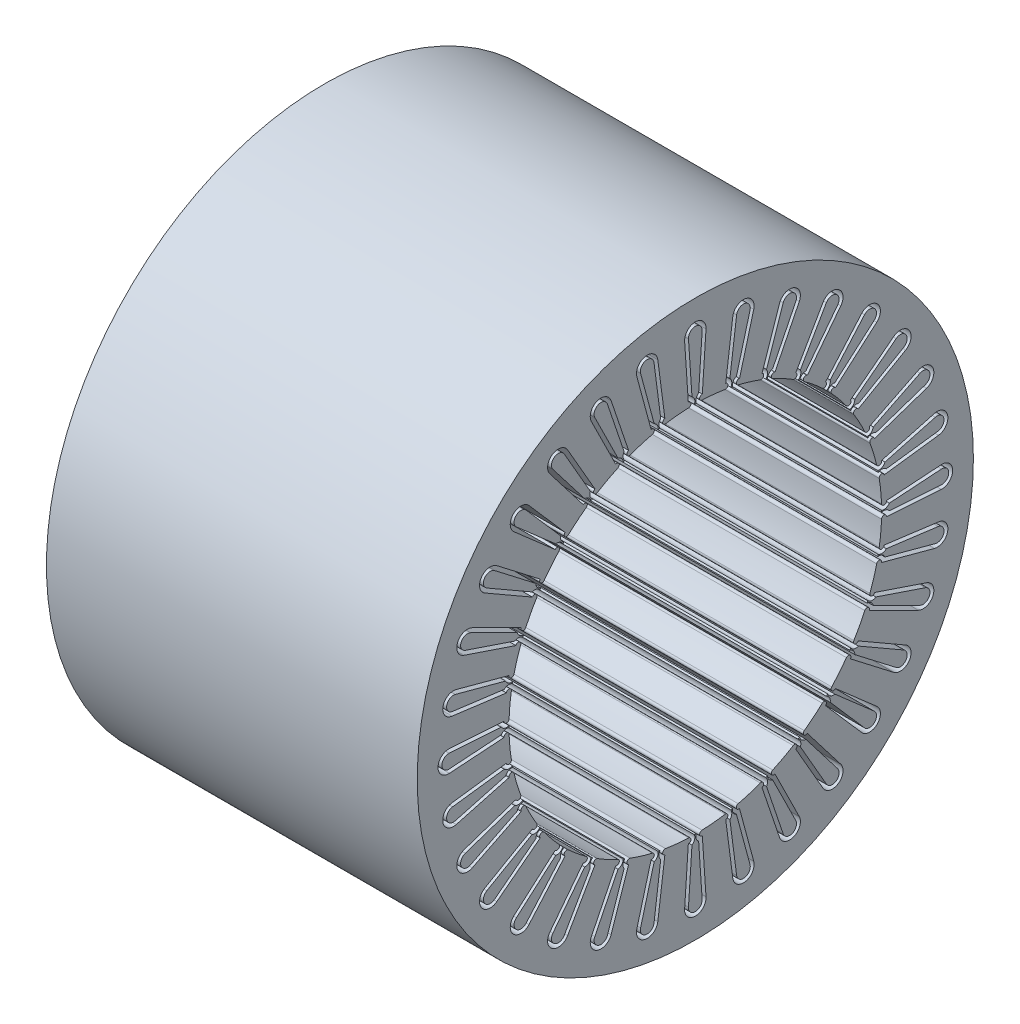
from build123d import *

# Parameters (mm, degrees)
SKETCH1_R               = 150
SKETCH1_R_2             = 100.5
BOSS_EXTRUDE1_DEPTH     = 200
CUT_EXTRUDE_THIN3_DEPTH = 200


with BuildPart() as part:
    # Sketch1 → Boss-Extrude1 (new body)
    with BuildSketch(Plane(origin=(0, 0, 0), x_dir=(0, 0, -1), z_dir=(1, 0, 0))):
        Circle(SKETCH1_R)
        Circle(SKETCH1_R_2, mode=Mode.SUBTRACT)
    extrude(amount=BOSS_EXTRUDE1_DEPTH)

    # Sketch2 → Cut-Extrude-Thin3 (cut)
    with BuildSketch(Plane(origin=(200, 0, 0), x_dir=(0, 0, -1), z_dir=(1, 0, 0))):
        with BuildLine():
            ThreePointArc((-3.689655933, 100.432248004), (-2.327243495, 101.84122861), (-3.781201437, 103.155534626))
            Line((-3.781201437, 103.155534626), (-5.76444464, 132.62086222))
            ThreePointArc((-5.76444464, 132.62086222), (0, 138.786340976), (5.76444464, 132.62086222))
            Line((5.76444464, 132.62086222), (3.781201437, 103.155534626))
            ThreePointArc((3.781201437, 103.155534626), (2.327243495, 101.84122861), (3.689655933, 100.432248004))
            Line((3.689655933, 100.432248004), (3.689655933, 98.352248004))
            ThreePointArc((3.689655933, 98.352248004), (0.39094782, 100.808501907), (1.798621582, 104.672840535))
            Line((1.798621582, 104.672840535), (3.68914023, 132.76054617))
            ThreePointArc((3.68914023, 132.76054617), (0, 136.706340976), (-3.68914023, 132.76054617))
            Line((-3.68914023, 132.76054617), (-1.798621582, 104.672840535))
            ThreePointArc((-1.798621582, 104.672840535), (-0.39094782, 100.808501907), (-3.689655933, 98.352248004))
            Line((-3.689655933, 98.352248004), (-3.689655933, 100.432248004))
        make_face()
        with BuildLine():
            ThreePointArc((23.212119833, 97.782654356), (22.150764248, 99.430355276), (23.83319318, 100.435754148))
            Line((23.83319318, 100.435754148), (31.526729169, 128.948002178))
            ThreePointArc((31.526729169, 128.948002178), (27.075871952, 136.11960035), (20.219364264, 131.197176901))
            Line((20.219364264, 131.197176901), (16.416099756, 101.91110576))
            ThreePointArc((16.416099756, 101.91110576), (17.58571192, 100.338400642), (15.974599375, 99.222286684))
            Line((15.974599375, 99.222286684), (15.568811505, 97.182253301))
            ThreePointArc((15.568811505, 97.182253301), (19.283327231, 98.947764946), (18.656596594, 103.012474918))
            Line((18.656596594, 103.012474918), (22.282043268, 130.929305058))
            ThreePointArc((22.282043268, 130.929305058), (26.670084083, 134.079566967), (29.518552139, 129.489873947))
            Line((29.518552139, 129.489873947), (22.184719739, 102.310687591))
            ThreePointArc((22.184719739, 102.310687591), (20.050198967, 98.795224673), (22.806331963, 95.742620972))
            Line((22.806331963, 95.742620972), (23.212119833, 97.782654356))
        make_face()
        with BuildLine():
            ThreePointArc((41.842554985, 91.375328138), (41.123043553, 93.19842915), (42.969288674, 93.856283962))
            Line((42.969288674, 93.856283962), (56.077459177, 120.319742728))
            ThreePointArc((56.077459177, 120.319742728), (53.11123333, 128.22185982), (45.426154338, 124.731657649))
            Line((45.426154338, 124.731657649), (35.982539442, 96.750290251))
            ThreePointArc((35.982539442, 96.750290251), (36.822858288, 94.979624207), (35.024959787, 94.199268532))
            Line((35.024959787, 94.199268532), (34.228978248, 92.277599104))
            ThreePointArc((34.228978248, 92.277599104), (38.216554832, 93.284520868), (38.394852225, 97.39339766))
            Line((38.394852225, 97.39339766), (47.39694034, 124.066524178))
            ThreePointArc((47.39694034, 124.066524178), (52.315251791, 126.300190392), (54.213582642, 121.242978486))
            Line((54.213582642, 121.242978486), (41.718271557, 96.016792299))
            ThreePointArc((41.718271557, 96.016792299), (38.938932211, 92.985302361), (41.046573446, 89.45365871))
            Line((41.046573446, 89.45365871), (41.842554985, 91.375328138))
        make_face()
        with BuildLine():
            ThreePointArc((58.865004215, 81.456499304), (58.514987357, 83.384939658), (60.454098502, 83.669969419))
            Line((60.454098502, 83.669969419), (78.473163877, 107.067663041))
            ThreePointArc((78.473163877, 107.067663041), (77.105559796, 115.396625124), (68.887242776, 113.472770745))
            Line((68.887242776, 113.472770745), (54.166190317, 87.871415346))
            ThreePointArc((54.166190317, 87.871415346), (54.644922863, 85.97083408), (52.729330638, 85.556225317))
            Line((52.729330638, 85.556225317), (51.573744553, 83.826768523))
            ThreePointArc((51.573744553, 83.826768523), (55.681141662, 84.036404969), (56.657615217, 88.031546749))
            Line((56.657615217, 88.031546749), (70.690399575, 112.435936351))
            ThreePointArc((70.690399575, 112.435936351), (75.949973711, 113.667168331), (76.825215569, 108.336783356))
            Line((76.825215569, 108.336783356), (59.648613596, 86.033025527))
            ThreePointArc((59.648613596, 86.033025527), (56.331264127, 83.602007025), (57.70941813, 79.72704251))
            Line((57.70941813, 79.72704251), (58.865004215, 81.456499304))
        make_face()
        with BuildLine():
            ThreePointArc((73.625304344, 68.407342883), (73.658233011, 70.367013698), (75.615691228, 70.268264874))
            Line((75.615691228, 70.268264874), (97.853188897, 89.701033107))
            ThreePointArc((97.853188897, 89.701033107), (98.13676284, 98.13676284), (89.701033107, 97.853188897))
            Line((89.701033107, 97.853188897), (70.268264874, 75.615691228))
            ThreePointArc((70.268264874, 75.615691228), (70.367013698, 73.658233011), (68.407342883, 73.625304344))
            Line((68.407342883, 73.625304344), (66.936560778, 72.154522239))
            ThreePointArc((66.936560778, 72.154522239), (71.005933444, 71.558817154), (72.743057831, 75.286692865))
            Line((72.743057831, 75.286692865), (91.267266397, 96.484498545))
            ThreePointArc((91.267266397, 96.484498545), (96.665980735, 96.665980735), (96.484498545, 91.267266397))
            Line((96.484498545, 91.267266397), (75.286692865, 72.743057831))
            ThreePointArc((75.286692865, 72.743057831), (71.558817154, 71.005933444), (72.154522239, 66.936560778))
            Line((72.154522239, 66.936560778), (73.625304344, 68.407342883))
        make_face()
        with BuildLine():
            ThreePointArc((85.556225317, 52.729330638), (85.97083408, 54.644922863), (87.871415346, 54.166190317))
            Line((87.871415346, 54.166190317), (113.472770745, 68.887242776))
            ThreePointArc((113.472770745, 68.887242776), (115.396625124, 77.105559796), (107.067663041, 78.473163877))
            Line((107.067663041, 78.473163877), (83.669969419, 60.454098502))
            ThreePointArc((83.669969419, 60.454098502), (83.384939658, 58.514987357), (81.456499304, 58.865004215))
            Line((81.456499304, 58.865004215), (79.72704251, 57.70941813))
            ThreePointArc((79.72704251, 57.70941813), (83.602007025, 56.331264127), (86.033025527, 59.648613596))
            Line((86.033025527, 59.648613596), (108.336783356, 76.825215569))
            ThreePointArc((108.336783356, 76.825215569), (113.667168331, 75.949973711), (112.435936351, 70.690399575))
            Line((112.435936351, 70.690399575), (88.031546749, 56.657615217))
            ThreePointArc((88.031546749, 56.657615217), (84.036404969, 55.681141662), (83.826768523, 51.573744553))
            Line((83.826768523, 51.573744553), (85.556225317, 52.729330638))
        make_face()
        with BuildLine():
            ThreePointArc((94.199268532, 35.024959787), (94.979624207, 36.822858288), (96.750290251, 35.982539442))
            Line((96.750290251, 35.982539442), (124.731657649, 45.426154338))
            ThreePointArc((124.731657649, 45.426154338), (128.22185982, 53.11123333), (120.319742728, 56.077459177))
            Line((120.319742728, 56.077459177), (93.856283962, 42.969288674))
            ThreePointArc((93.856283962, 42.969288674), (93.19842915, 41.123043553), (91.375328138, 41.842554985))
            Line((91.375328138, 41.842554985), (89.45365871, 41.046573446))
            ThreePointArc((89.45365871, 41.046573446), (92.985302361, 38.938932211), (96.016792299, 41.718271557))
            Line((96.016792299, 41.718271557), (121.242978486, 54.213582642))
            ThreePointArc((121.242978486, 54.213582642), (126.300190392, 52.315251791), (124.066524178, 47.39694034))
            Line((124.066524178, 47.39694034), (97.39339766, 38.394852225))
            ThreePointArc((97.39339766, 38.394852225), (93.284520868, 38.216554832), (92.277599104, 34.228978248))
            Line((92.277599104, 34.228978248), (94.199268532, 35.024959787))
        make_face()
        with BuildLine():
            ThreePointArc((99.222286684, 15.974599375), (100.338400642, 17.58571192), (101.91110576, 16.416099756))
            Line((101.91110576, 16.416099756), (131.197176901, 20.219364264))
            ThreePointArc((131.197176901, 20.219364264), (136.11960035, 27.075871952), (128.948002178, 31.526729169))
            Line((128.948002178, 31.526729169), (100.435754148, 23.83319318))
            ThreePointArc((100.435754148, 23.83319318), (99.430355276, 22.150764248), (97.782654356, 23.212119833))
            Line((97.782654356, 23.212119833), (95.742620972, 22.806331963))
            ThreePointArc((95.742620972, 22.806331963), (98.795224673, 20.050198967), (102.310687591, 22.184719739))
            Line((102.310687591, 22.184719739), (129.489873947, 29.518552139))
            ThreePointArc((129.489873947, 29.518552139), (134.079566967, 26.670084083), (130.929305058, 22.282043268))
            Line((130.929305058, 22.282043268), (103.012474918, 18.656596594))
            ThreePointArc((103.012474918, 18.656596594), (98.947764946, 19.283327231), (97.182253301, 15.568811505))
            Line((97.182253301, 15.568811505), (99.222286684, 15.974599375))
        make_face()
        with BuildLine():
            ThreePointArc((100.432248004, -3.689655933), (101.84122861, -2.327243495), (103.155534626, -3.781201437))
            Line((103.155534626, -3.781201437), (132.62086222, -5.76444464))
            ThreePointArc((132.62086222, -5.76444464), (138.786340976, 0), (132.62086222, 5.76444464))
            Line((132.62086222, 5.76444464), (103.155534626, 3.781201437))
            ThreePointArc((103.155534626, 3.781201437), (101.84122861, 2.327243495), (100.432248004, 3.689655933))
            Line((100.432248004, 3.689655933), (98.352248004, 3.689655933))
            ThreePointArc((98.352248004, 3.689655933), (100.808501907, 0.39094782), (104.672840535, 1.798621582))
            Line((104.672840535, 1.798621582), (132.76054617, 3.68914023))
            ThreePointArc((132.76054617, 3.68914023), (136.706340976, 0), (132.76054617, -3.68914023))
            Line((132.76054617, -3.68914023), (104.672840535, -1.798621582))
            ThreePointArc((104.672840535, -1.798621582), (100.808501907, -0.39094782), (98.352248004, -3.689655933))
            Line((98.352248004, -3.689655933), (100.432248004, -3.689655933))
        make_face()
        with BuildLine():
            ThreePointArc((97.782654356, -23.212119833), (99.430355276, -22.150764248), (100.435754148, -23.83319318))
            Line((100.435754148, -23.83319318), (128.948002178, -31.526729169))
            ThreePointArc((128.948002178, -31.526729169), (136.11960035, -27.075871952), (131.197176901, -20.219364264))
            Line((131.197176901, -20.219364264), (101.91110576, -16.416099756))
            ThreePointArc((101.91110576, -16.416099756), (100.338400642, -17.58571192), (99.222286684, -15.974599375))
            Line((99.222286684, -15.974599375), (97.182253301, -15.568811505))
            ThreePointArc((97.182253301, -15.568811505), (98.947764946, -19.283327231), (103.012474918, -18.656596594))
            Line((103.012474918, -18.656596594), (130.929305058, -22.282043268))
            ThreePointArc((130.929305058, -22.282043268), (134.079566967, -26.670084083), (129.489873947, -29.518552139))
            Line((129.489873947, -29.518552139), (102.310687591, -22.184719739))
            ThreePointArc((102.310687591, -22.184719739), (98.795224673, -20.050198967), (95.742620972, -22.806331963))
            Line((95.742620972, -22.806331963), (97.782654356, -23.212119833))
        make_face()
        with BuildLine():
            ThreePointArc((91.375328138, -41.842554985), (93.19842915, -41.123043553), (93.856283962, -42.969288674))
            Line((93.856283962, -42.969288674), (120.319742728, -56.077459177))
            ThreePointArc((120.319742728, -56.077459177), (128.22185982, -53.11123333), (124.731657649, -45.426154338))
            Line((124.731657649, -45.426154338), (96.750290251, -35.982539442))
            ThreePointArc((96.750290251, -35.982539442), (94.979624207, -36.822858288), (94.199268532, -35.024959787))
            Line((94.199268532, -35.024959787), (92.277599104, -34.228978248))
            ThreePointArc((92.277599104, -34.228978248), (93.284520868, -38.216554832), (97.39339766, -38.394852225))
            Line((97.39339766, -38.394852225), (124.066524178, -47.39694034))
            ThreePointArc((124.066524178, -47.39694034), (126.300190392, -52.315251791), (121.242978486, -54.213582642))
            Line((121.242978486, -54.213582642), (96.016792299, -41.718271557))
            ThreePointArc((96.016792299, -41.718271557), (92.985302361, -38.938932211), (89.45365871, -41.046573446))
            Line((89.45365871, -41.046573446), (91.375328138, -41.842554985))
        make_face()
        with BuildLine():
            ThreePointArc((81.456499304, -58.865004215), (83.384939658, -58.514987357), (83.669969419, -60.454098502))
            Line((83.669969419, -60.454098502), (107.067663041, -78.473163877))
            ThreePointArc((107.067663041, -78.473163877), (115.396625124, -77.105559796), (113.472770745, -68.887242776))
            Line((113.472770745, -68.887242776), (87.871415346, -54.166190317))
            ThreePointArc((87.871415346, -54.166190317), (85.97083408, -54.644922863), (85.556225317, -52.729330638))
            Line((85.556225317, -52.729330638), (83.826768523, -51.573744553))
            ThreePointArc((83.826768523, -51.573744553), (84.036404969, -55.681141662), (88.031546749, -56.657615217))
            Line((88.031546749, -56.657615217), (112.435936351, -70.690399575))
            ThreePointArc((112.435936351, -70.690399575), (113.667168331, -75.949973711), (108.336783356, -76.825215569))
            Line((108.336783356, -76.825215569), (86.033025527, -59.648613596))
            ThreePointArc((86.033025527, -59.648613596), (83.602007025, -56.331264127), (79.72704251, -57.70941813))
            Line((79.72704251, -57.70941813), (81.456499304, -58.865004215))
        make_face()
        with BuildLine():
            ThreePointArc((68.407342883, -73.625304344), (70.367013698, -73.658233011), (70.268264874, -75.615691228))
            Line((70.268264874, -75.615691228), (89.701033107, -97.853188897))
            ThreePointArc((89.701033107, -97.853188897), (98.13676284, -98.13676284), (97.853188897, -89.701033107))
            Line((97.853188897, -89.701033107), (75.615691228, -70.268264874))
            ThreePointArc((75.615691228, -70.268264874), (73.658233011, -70.367013698), (73.625304344, -68.407342883))
            Line((73.625304344, -68.407342883), (72.154522239, -66.936560778))
            ThreePointArc((72.154522239, -66.936560778), (71.558817154, -71.005933444), (75.286692865, -72.743057831))
            Line((75.286692865, -72.743057831), (96.484498545, -91.267266397))
            ThreePointArc((96.484498545, -91.267266397), (96.665980735, -96.665980735), (91.267266397, -96.484498545))
            Line((91.267266397, -96.484498545), (72.743057831, -75.286692865))
            ThreePointArc((72.743057831, -75.286692865), (71.005933444, -71.558817154), (66.936560778, -72.154522239))
            Line((66.936560778, -72.154522239), (68.407342883, -73.625304344))
        make_face()
        with BuildLine():
            ThreePointArc((52.729330638, -85.556225317), (54.644922863, -85.97083408), (54.166190317, -87.871415346))
            Line((54.166190317, -87.871415346), (68.887242776, -113.472770745))
            ThreePointArc((68.887242776, -113.472770745), (77.105559796, -115.396625124), (78.473163877, -107.067663041))
            Line((78.473163877, -107.067663041), (60.454098502, -83.669969419))
            ThreePointArc((60.454098502, -83.669969419), (58.514987357, -83.384939658), (58.865004215, -81.456499304))
            Line((58.865004215, -81.456499304), (57.70941813, -79.72704251))
            ThreePointArc((57.70941813, -79.72704251), (56.331264127, -83.602007025), (59.648613596, -86.033025527))
            Line((59.648613596, -86.033025527), (76.825215569, -108.336783356))
            ThreePointArc((76.825215569, -108.336783356), (75.949973711, -113.667168331), (70.690399575, -112.435936351))
            Line((70.690399575, -112.435936351), (56.657615217, -88.031546749))
            ThreePointArc((56.657615217, -88.031546749), (55.681141662, -84.036404969), (51.573744553, -83.826768523))
            Line((51.573744553, -83.826768523), (52.729330638, -85.556225317))
        make_face()
        with BuildLine():
            ThreePointArc((35.024959787, -94.199268532), (36.822858288, -94.979624207), (35.982539442, -96.750290251))
            Line((35.982539442, -96.750290251), (45.426154338, -124.731657649))
            ThreePointArc((45.426154338, -124.731657649), (53.11123333, -128.22185982), (56.077459177, -120.319742728))
            Line((56.077459177, -120.319742728), (42.969288674, -93.856283962))
            ThreePointArc((42.969288674, -93.856283962), (41.123043553, -93.19842915), (41.842554985, -91.375328138))
            Line((41.842554985, -91.375328138), (41.046573446, -89.45365871))
            ThreePointArc((41.046573446, -89.45365871), (38.938932211, -92.985302361), (41.718271557, -96.016792299))
            Line((41.718271557, -96.016792299), (54.213582642, -121.242978486))
            ThreePointArc((54.213582642, -121.242978486), (52.315251791, -126.300190392), (47.39694034, -124.066524178))
            Line((47.39694034, -124.066524178), (38.394852225, -97.39339766))
            ThreePointArc((38.394852225, -97.39339766), (38.216554832, -93.284520868), (34.228978248, -92.277599104))
            Line((34.228978248, -92.277599104), (35.024959787, -94.199268532))
        make_face()
        with BuildLine():
            ThreePointArc((15.974599375, -99.222286684), (17.58571192, -100.338400642), (16.416099756, -101.91110576))
            Line((16.416099756, -101.91110576), (20.219364264, -131.197176901))
            ThreePointArc((20.219364264, -131.197176901), (27.075871952, -136.11960035), (31.526729169, -128.948002178))
            Line((31.526729169, -128.948002178), (23.83319318, -100.435754148))
            ThreePointArc((23.83319318, -100.435754148), (22.150764248, -99.430355276), (23.212119833, -97.782654356))
            Line((23.212119833, -97.782654356), (22.806331963, -95.742620972))
            ThreePointArc((22.806331963, -95.742620972), (20.050198967, -98.795224673), (22.184719739, -102.310687591))
            Line((22.184719739, -102.310687591), (29.518552139, -129.489873947))
            ThreePointArc((29.518552139, -129.489873947), (26.670084083, -134.079566967), (22.282043268, -130.929305058))
            Line((22.282043268, -130.929305058), (18.656596594, -103.012474918))
            ThreePointArc((18.656596594, -103.012474918), (19.283327231, -98.947764946), (15.568811505, -97.182253301))
            Line((15.568811505, -97.182253301), (15.974599375, -99.222286684))
        make_face()
        with BuildLine():
            ThreePointArc((-3.689655933, -100.432248004), (-2.327243495, -101.84122861), (-3.781201437, -103.155534626))
            Line((-3.781201437, -103.155534626), (-5.76444464, -132.62086222))
            ThreePointArc((-5.76444464, -132.62086222), (0, -138.786340976), (5.76444464, -132.62086222))
            Line((5.76444464, -132.62086222), (3.781201437, -103.155534626))
            ThreePointArc((3.781201437, -103.155534626), (2.327243495, -101.84122861), (3.689655933, -100.432248004))
            Line((3.689655933, -100.432248004), (3.689655933, -98.352248004))
            ThreePointArc((3.689655933, -98.352248004), (0.39094782, -100.808501907), (1.798621582, -104.672840535))
            Line((1.798621582, -104.672840535), (3.68914023, -132.76054617))
            ThreePointArc((3.68914023, -132.76054617), (0, -136.706340976), (-3.68914023, -132.76054617))
            Line((-3.68914023, -132.76054617), (-1.798621582, -104.672840535))
            ThreePointArc((-1.798621582, -104.672840535), (-0.39094782, -100.808501907), (-3.689655933, -98.352248004))
            Line((-3.689655933, -98.352248004), (-3.689655933, -100.432248004))
        make_face()
        with BuildLine():
            ThreePointArc((-23.212119833, -97.782654356), (-22.150764248, -99.430355276), (-23.83319318, -100.435754148))
            Line((-23.83319318, -100.435754148), (-31.526729169, -128.948002178))
            ThreePointArc((-31.526729169, -128.948002178), (-27.075871952, -136.11960035), (-20.219364264, -131.197176901))
            Line((-20.219364264, -131.197176901), (-16.416099756, -101.91110576))
            ThreePointArc((-16.416099756, -101.91110576), (-17.58571192, -100.338400642), (-15.974599375, -99.222286684))
            Line((-15.974599375, -99.222286684), (-15.568811505, -97.182253301))
            ThreePointArc((-15.568811505, -97.182253301), (-19.283327231, -98.947764946), (-18.656596594, -103.012474918))
            Line((-18.656596594, -103.012474918), (-22.282043268, -130.929305058))
            ThreePointArc((-22.282043268, -130.929305058), (-26.670084083, -134.079566967), (-29.518552139, -129.489873947))
            Line((-29.518552139, -129.489873947), (-22.184719739, -102.310687591))
            ThreePointArc((-22.184719739, -102.310687591), (-20.050198967, -98.795224673), (-22.806331963, -95.742620972))
            Line((-22.806331963, -95.742620972), (-23.212119833, -97.782654356))
        make_face()
        with BuildLine():
            ThreePointArc((-41.842554985, -91.375328138), (-41.123043553, -93.19842915), (-42.969288674, -93.856283962))
            Line((-42.969288674, -93.856283962), (-56.077459177, -120.319742728))
            ThreePointArc((-56.077459177, -120.319742728), (-53.11123333, -128.22185982), (-45.426154338, -124.731657649))
            Line((-45.426154338, -124.731657649), (-35.982539442, -96.750290251))
            ThreePointArc((-35.982539442, -96.750290251), (-36.822858288, -94.979624207), (-35.024959787, -94.199268532))
            Line((-35.024959787, -94.199268532), (-34.228978248, -92.277599104))
            ThreePointArc((-34.228978248, -92.277599104), (-38.216554832, -93.284520868), (-38.394852225, -97.39339766))
            Line((-38.394852225, -97.39339766), (-47.39694034, -124.066524178))
            ThreePointArc((-47.39694034, -124.066524178), (-52.315251791, -126.300190392), (-54.213582642, -121.242978486))
            Line((-54.213582642, -121.242978486), (-41.718271557, -96.016792299))
            ThreePointArc((-41.718271557, -96.016792299), (-38.938932211, -92.985302361), (-41.046573446, -89.45365871))
            Line((-41.046573446, -89.45365871), (-41.842554985, -91.375328138))
        make_face()
        with BuildLine():
            ThreePointArc((-58.865004215, -81.456499304), (-58.514987357, -83.384939658), (-60.454098502, -83.669969419))
            Line((-60.454098502, -83.669969419), (-78.473163877, -107.067663041))
            ThreePointArc((-78.473163877, -107.067663041), (-77.105559796, -115.396625124), (-68.887242776, -113.472770745))
            Line((-68.887242776, -113.472770745), (-54.166190317, -87.871415346))
            ThreePointArc((-54.166190317, -87.871415346), (-54.644922863, -85.97083408), (-52.729330638, -85.556225317))
            Line((-52.729330638, -85.556225317), (-51.573744553, -83.826768523))
            ThreePointArc((-51.573744553, -83.826768523), (-55.681141662, -84.036404969), (-56.657615217, -88.031546749))
            Line((-56.657615217, -88.031546749), (-70.690399575, -112.435936351))
            ThreePointArc((-70.690399575, -112.435936351), (-75.949973711, -113.667168331), (-76.825215569, -108.336783356))
            Line((-76.825215569, -108.336783356), (-59.648613596, -86.033025527))
            ThreePointArc((-59.648613596, -86.033025527), (-56.331264127, -83.602007025), (-57.70941813, -79.72704251))
            Line((-57.70941813, -79.72704251), (-58.865004215, -81.456499304))
        make_face()
        with BuildLine():
            ThreePointArc((-73.625304344, -68.407342883), (-73.658233011, -70.367013698), (-75.615691228, -70.268264874))
            Line((-75.615691228, -70.268264874), (-97.853188897, -89.701033107))
            ThreePointArc((-97.853188897, -89.701033107), (-98.13676284, -98.13676284), (-89.701033107, -97.853188897))
            Line((-89.701033107, -97.853188897), (-70.268264874, -75.615691228))
            ThreePointArc((-70.268264874, -75.615691228), (-70.367013698, -73.658233011), (-68.407342883, -73.625304344))
            Line((-68.407342883, -73.625304344), (-66.936560778, -72.154522239))
            ThreePointArc((-66.936560778, -72.154522239), (-71.005933444, -71.558817154), (-72.743057831, -75.286692865))
            Line((-72.743057831, -75.286692865), (-91.267266397, -96.484498545))
            ThreePointArc((-91.267266397, -96.484498545), (-96.665980735, -96.665980735), (-96.484498545, -91.267266397))
            Line((-96.484498545, -91.267266397), (-75.286692865, -72.743057831))
            ThreePointArc((-75.286692865, -72.743057831), (-71.558817154, -71.005933444), (-72.154522239, -66.936560778))
            Line((-72.154522239, -66.936560778), (-73.625304344, -68.407342883))
        make_face()
        with BuildLine():
            ThreePointArc((-85.556225317, -52.729330638), (-85.97083408, -54.644922863), (-87.871415346, -54.166190317))
            Line((-87.871415346, -54.166190317), (-113.472770745, -68.887242776))
            ThreePointArc((-113.472770745, -68.887242776), (-115.396625124, -77.105559796), (-107.067663041, -78.473163877))
            Line((-107.067663041, -78.473163877), (-83.669969419, -60.454098502))
            ThreePointArc((-83.669969419, -60.454098502), (-83.384939658, -58.514987357), (-81.456499304, -58.865004215))
            Line((-81.456499304, -58.865004215), (-79.72704251, -57.70941813))
            ThreePointArc((-79.72704251, -57.70941813), (-83.602007025, -56.331264127), (-86.033025527, -59.648613596))
            Line((-86.033025527, -59.648613596), (-108.336783356, -76.825215569))
            ThreePointArc((-108.336783356, -76.825215569), (-113.667168331, -75.949973711), (-112.435936351, -70.690399575))
            Line((-112.435936351, -70.690399575), (-88.031546749, -56.657615217))
            ThreePointArc((-88.031546749, -56.657615217), (-84.036404969, -55.681141662), (-83.826768523, -51.573744553))
            Line((-83.826768523, -51.573744553), (-85.556225317, -52.729330638))
        make_face()
        with BuildLine():
            ThreePointArc((-94.199268532, -35.024959787), (-94.979624207, -36.822858288), (-96.750290251, -35.982539442))
            Line((-96.750290251, -35.982539442), (-124.731657649, -45.426154338))
            ThreePointArc((-124.731657649, -45.426154338), (-128.22185982, -53.11123333), (-120.319742728, -56.077459177))
            Line((-120.319742728, -56.077459177), (-93.856283962, -42.969288674))
            ThreePointArc((-93.856283962, -42.969288674), (-93.19842915, -41.123043553), (-91.375328138, -41.842554985))
            Line((-91.375328138, -41.842554985), (-89.45365871, -41.046573446))
            ThreePointArc((-89.45365871, -41.046573446), (-92.985302361, -38.938932211), (-96.016792299, -41.718271557))
            Line((-96.016792299, -41.718271557), (-121.242978486, -54.213582642))
            ThreePointArc((-121.242978486, -54.213582642), (-126.300190392, -52.315251791), (-124.066524178, -47.39694034))
            Line((-124.066524178, -47.39694034), (-97.39339766, -38.394852225))
            ThreePointArc((-97.39339766, -38.394852225), (-93.284520868, -38.216554832), (-92.277599104, -34.228978248))
            Line((-92.277599104, -34.228978248), (-94.199268532, -35.024959787))
        make_face()
        with BuildLine():
            ThreePointArc((-99.222286684, -15.974599375), (-100.338400642, -17.58571192), (-101.91110576, -16.416099756))
            Line((-101.91110576, -16.416099756), (-131.197176901, -20.219364264))
            ThreePointArc((-131.197176901, -20.219364264), (-136.11960035, -27.075871952), (-128.948002178, -31.526729169))
            Line((-128.948002178, -31.526729169), (-100.435754148, -23.83319318))
            ThreePointArc((-100.435754148, -23.83319318), (-99.430355276, -22.150764248), (-97.782654356, -23.212119833))
            Line((-97.782654356, -23.212119833), (-95.742620972, -22.806331963))
            ThreePointArc((-95.742620972, -22.806331963), (-98.795224673, -20.050198967), (-102.310687591, -22.184719739))
            Line((-102.310687591, -22.184719739), (-129.489873947, -29.518552139))
            ThreePointArc((-129.489873947, -29.518552139), (-134.079566967, -26.670084083), (-130.929305058, -22.282043268))
            Line((-130.929305058, -22.282043268), (-103.012474918, -18.656596594))
            ThreePointArc((-103.012474918, -18.656596594), (-98.947764946, -19.283327231), (-97.182253301, -15.568811505))
            Line((-97.182253301, -15.568811505), (-99.222286684, -15.974599375))
        make_face()
        with BuildLine():
            ThreePointArc((-100.432248004, 3.689655933), (-101.84122861, 2.327243495), (-103.155534626, 3.781201437))
            Line((-103.155534626, 3.781201437), (-132.62086222, 5.76444464))
            ThreePointArc((-132.62086222, 5.76444464), (-138.786340976, 0), (-132.62086222, -5.76444464))
            Line((-132.62086222, -5.76444464), (-103.155534626, -3.781201437))
            ThreePointArc((-103.155534626, -3.781201437), (-101.84122861, -2.327243495), (-100.432248004, -3.689655933))
            Line((-100.432248004, -3.689655933), (-98.352248004, -3.689655933))
            ThreePointArc((-98.352248004, -3.689655933), (-100.808501907, -0.39094782), (-104.672840535, -1.798621582))
            Line((-104.672840535, -1.798621582), (-132.76054617, -3.68914023))
            ThreePointArc((-132.76054617, -3.68914023), (-136.706340976, 0), (-132.76054617, 3.68914023))
            Line((-132.76054617, 3.68914023), (-104.672840535, 1.798621582))
            ThreePointArc((-104.672840535, 1.798621582), (-100.808501907, 0.39094782), (-98.352248004, 3.689655933))
            Line((-98.352248004, 3.689655933), (-100.432248004, 3.689655933))
        make_face()
        with BuildLine():
            ThreePointArc((-97.782654356, 23.212119833), (-99.430355276, 22.150764248), (-100.435754148, 23.83319318))
            Line((-100.435754148, 23.83319318), (-128.948002178, 31.526729169))
            ThreePointArc((-128.948002178, 31.526729169), (-136.11960035, 27.075871952), (-131.197176901, 20.219364264))
            Line((-131.197176901, 20.219364264), (-101.91110576, 16.416099756))
            ThreePointArc((-101.91110576, 16.416099756), (-100.338400642, 17.58571192), (-99.222286684, 15.974599375))
            Line((-99.222286684, 15.974599375), (-97.182253301, 15.568811505))
            ThreePointArc((-97.182253301, 15.568811505), (-98.947764946, 19.283327231), (-103.012474918, 18.656596594))
            Line((-103.012474918, 18.656596594), (-130.929305058, 22.282043268))
            ThreePointArc((-130.929305058, 22.282043268), (-134.079566967, 26.670084083), (-129.489873947, 29.518552139))
            Line((-129.489873947, 29.518552139), (-102.310687591, 22.184719739))
            ThreePointArc((-102.310687591, 22.184719739), (-98.795224673, 20.050198967), (-95.742620972, 22.806331963))
            Line((-95.742620972, 22.806331963), (-97.782654356, 23.212119833))
        make_face()
        with BuildLine():
            ThreePointArc((-91.375328138, 41.842554985), (-93.19842915, 41.123043553), (-93.856283962, 42.969288674))
            Line((-93.856283962, 42.969288674), (-120.319742728, 56.077459177))
            ThreePointArc((-120.319742728, 56.077459177), (-128.22185982, 53.11123333), (-124.731657649, 45.426154338))
            Line((-124.731657649, 45.426154338), (-96.750290251, 35.982539442))
            ThreePointArc((-96.750290251, 35.982539442), (-94.979624207, 36.822858288), (-94.199268532, 35.024959787))
            Line((-94.199268532, 35.024959787), (-92.277599104, 34.228978248))
            ThreePointArc((-92.277599104, 34.228978248), (-93.284520868, 38.216554832), (-97.39339766, 38.394852225))
            Line((-97.39339766, 38.394852225), (-124.066524178, 47.39694034))
            ThreePointArc((-124.066524178, 47.39694034), (-126.300190392, 52.315251791), (-121.242978486, 54.213582642))
            Line((-121.242978486, 54.213582642), (-96.016792299, 41.718271557))
            ThreePointArc((-96.016792299, 41.718271557), (-92.985302361, 38.938932211), (-89.45365871, 41.046573446))
            Line((-89.45365871, 41.046573446), (-91.375328138, 41.842554985))
        make_face()
        with BuildLine():
            ThreePointArc((-81.456499304, 58.865004215), (-83.384939658, 58.514987357), (-83.669969419, 60.454098502))
            Line((-83.669969419, 60.454098502), (-107.067663041, 78.473163877))
            ThreePointArc((-107.067663041, 78.473163877), (-115.396625124, 77.105559796), (-113.472770745, 68.887242776))
            Line((-113.472770745, 68.887242776), (-87.871415346, 54.166190317))
            ThreePointArc((-87.871415346, 54.166190317), (-85.97083408, 54.644922863), (-85.556225317, 52.729330638))
            Line((-85.556225317, 52.729330638), (-83.826768523, 51.573744553))
            ThreePointArc((-83.826768523, 51.573744553), (-84.036404969, 55.681141662), (-88.031546749, 56.657615217))
            Line((-88.031546749, 56.657615217), (-112.435936351, 70.690399575))
            ThreePointArc((-112.435936351, 70.690399575), (-113.667168331, 75.949973711), (-108.336783356, 76.825215569))
            Line((-108.336783356, 76.825215569), (-86.033025527, 59.648613596))
            ThreePointArc((-86.033025527, 59.648613596), (-83.602007025, 56.331264127), (-79.72704251, 57.70941813))
            Line((-79.72704251, 57.70941813), (-81.456499304, 58.865004215))
        make_face()
        with BuildLine():
            ThreePointArc((-68.407342883, 73.625304344), (-70.367013698, 73.658233011), (-70.268264874, 75.615691228))
            Line((-70.268264874, 75.615691228), (-89.701033107, 97.853188897))
            ThreePointArc((-89.701033107, 97.853188897), (-98.13676284, 98.13676284), (-97.853188897, 89.701033107))
            Line((-97.853188897, 89.701033107), (-75.615691228, 70.268264874))
            ThreePointArc((-75.615691228, 70.268264874), (-73.658233011, 70.367013698), (-73.625304344, 68.407342883))
            Line((-73.625304344, 68.407342883), (-72.154522239, 66.936560778))
            ThreePointArc((-72.154522239, 66.936560778), (-71.558817154, 71.005933444), (-75.286692865, 72.743057831))
            Line((-75.286692865, 72.743057831), (-96.484498545, 91.267266397))
            ThreePointArc((-96.484498545, 91.267266397), (-96.665980735, 96.665980735), (-91.267266397, 96.484498545))
            Line((-91.267266397, 96.484498545), (-72.743057831, 75.286692865))
            ThreePointArc((-72.743057831, 75.286692865), (-71.005933444, 71.558817154), (-66.936560778, 72.154522239))
            Line((-66.936560778, 72.154522239), (-68.407342883, 73.625304344))
        make_face()
        with BuildLine():
            ThreePointArc((-52.729330638, 85.556225317), (-54.644922863, 85.97083408), (-54.166190317, 87.871415346))
            Line((-54.166190317, 87.871415346), (-68.887242776, 113.472770745))
            ThreePointArc((-68.887242776, 113.472770745), (-77.105559796, 115.396625124), (-78.473163877, 107.067663041))
            Line((-78.473163877, 107.067663041), (-60.454098502, 83.669969419))
            ThreePointArc((-60.454098502, 83.669969419), (-58.514987357, 83.384939658), (-58.865004215, 81.456499304))
            Line((-58.865004215, 81.456499304), (-57.70941813, 79.72704251))
            ThreePointArc((-57.70941813, 79.72704251), (-56.331264127, 83.602007025), (-59.648613596, 86.033025527))
            Line((-59.648613596, 86.033025527), (-76.825215569, 108.336783356))
            ThreePointArc((-76.825215569, 108.336783356), (-75.949973711, 113.667168331), (-70.690399575, 112.435936351))
            Line((-70.690399575, 112.435936351), (-56.657615217, 88.031546749))
            ThreePointArc((-56.657615217, 88.031546749), (-55.681141662, 84.036404969), (-51.573744553, 83.826768523))
            Line((-51.573744553, 83.826768523), (-52.729330638, 85.556225317))
        make_face()
        with BuildLine():
            ThreePointArc((-35.024959787, 94.199268532), (-36.822858288, 94.979624207), (-35.982539442, 96.750290251))
            Line((-35.982539442, 96.750290251), (-45.426154338, 124.731657649))
            ThreePointArc((-45.426154338, 124.731657649), (-53.11123333, 128.22185982), (-56.077459177, 120.319742728))
            Line((-56.077459177, 120.319742728), (-42.969288674, 93.856283962))
            ThreePointArc((-42.969288674, 93.856283962), (-41.123043553, 93.19842915), (-41.842554985, 91.375328138))
            Line((-41.842554985, 91.375328138), (-41.046573446, 89.45365871))
            ThreePointArc((-41.046573446, 89.45365871), (-38.938932211, 92.985302361), (-41.718271557, 96.016792299))
            Line((-41.718271557, 96.016792299), (-54.213582642, 121.242978486))
            ThreePointArc((-54.213582642, 121.242978486), (-52.315251791, 126.300190392), (-47.39694034, 124.066524178))
            Line((-47.39694034, 124.066524178), (-38.394852225, 97.39339766))
            ThreePointArc((-38.394852225, 97.39339766), (-38.216554832, 93.284520868), (-34.228978248, 92.277599104))
            Line((-34.228978248, 92.277599104), (-35.024959787, 94.199268532))
        make_face()
        with BuildLine():
            ThreePointArc((-15.974599375, 99.222286684), (-17.58571192, 100.338400642), (-16.416099756, 101.91110576))
            Line((-16.416099756, 101.91110576), (-20.219364264, 131.197176901))
            ThreePointArc((-20.219364264, 131.197176901), (-27.075871952, 136.11960035), (-31.526729169, 128.948002178))
            Line((-31.526729169, 128.948002178), (-23.83319318, 100.435754148))
            ThreePointArc((-23.83319318, 100.435754148), (-22.150764248, 99.430355276), (-23.212119833, 97.782654356))
            Line((-23.212119833, 97.782654356), (-22.806331963, 95.742620972))
            ThreePointArc((-22.806331963, 95.742620972), (-20.050198967, 98.795224673), (-22.184719739, 102.310687591))
            Line((-22.184719739, 102.310687591), (-29.518552139, 129.489873947))
            ThreePointArc((-29.518552139, 129.489873947), (-26.670084083, 134.079566967), (-22.282043268, 130.929305058))
            Line((-22.282043268, 130.929305058), (-18.656596594, 103.012474918))
            ThreePointArc((-18.656596594, 103.012474918), (-19.283327231, 98.947764946), (-15.568811505, 97.182253301))
            Line((-15.568811505, 97.182253301), (-15.974599375, 99.222286684))
        make_face()
    extrude(amount=-CUT_EXTRUDE_THIN3_DEPTH, mode=Mode.SUBTRACT)


solid = part.part
